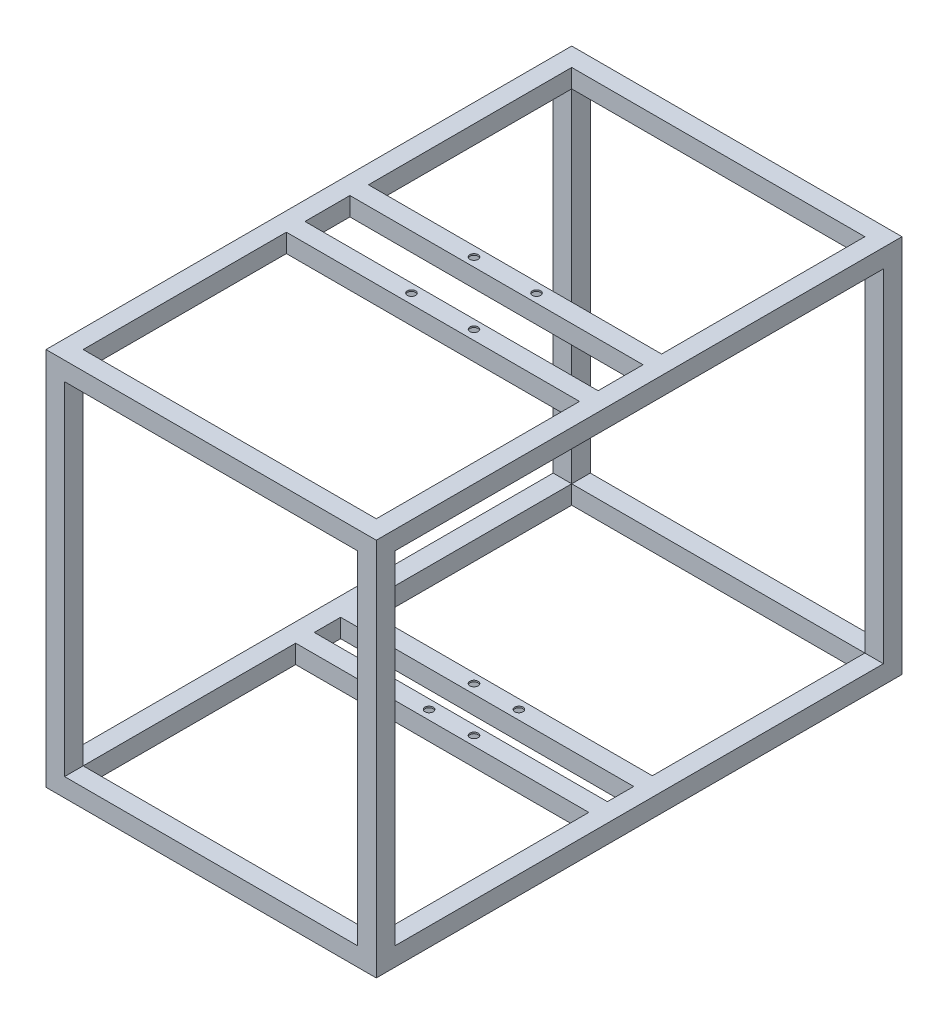
from build123d import *

# Parameters (mm, degrees)
SKETCH2_W                    = 19
SKETCH2_H                    = 19
SKETCH2_W_2                  = 16.6
SKETCH2_H_2                  = 16.6
SKETCH4_W                    = 19
SKETCH4_H                    = 19
SKETCH4_W_2                  = 16
SKETCH4_H_2                  = 16
SKETCH11_W                   = 19
SKETCH11_H                   = 19
SKETCH11_W_2                 = 16
SKETCH11_H_2                 = 16
M8_CLEARANCE_HOLE2_D         = 8.4
SKETCH15_W                   = 19
SKETCH15_H                   = 19
SKETCH15_W_2                 = 16
SKETCH15_H_2                 = 16
M8_START                     = -9.5
M8_CLEARANCE_HOLE1_OUTLINE_R = 4.2
M8_CLEARANCE_HOLE1_DEPTH     = 19


# Read off the part's stored shape, not the designer's step: M8 Clearance Hole1
with BuildPart() as part:
    # Sweep2: sweep along a path in Sketch1
    with BuildLine(Plane(origin=(0, 0, 0), x_dir=(1, 0, 0), z_dir=(0, 1, 0))) as sweep2_path:
        Line((150, 250), (-150, 250))
        Line((-150, 250), (-150, -250))
        Line((-150, -250), (150, -250))
        Line((150, -250), (150, 250))
    # Sketch2 → Sweep2 (sweep)
    with BuildSketch(Plane.XY):
        with Locations((-159.5, 0)):
            Rectangle(SKETCH2_W, SKETCH2_H)
        with Locations((-159.5, 0)):
            Rectangle(SKETCH2_W_2, SKETCH2_H_2, mode=Mode.SUBTRACT)
    sweep2 = sweep(path=sweep2_path.line, transition=Transition.RIGHT)

    # Sweep3: sweep along a path in Sketch3
    with BuildLine(Plane.XY.offset(250)) as sweep3_path:
        Line((-150, 9.5), (150, 9.5))
        Line((150, 9.5), (150, 359.5))
        Line((150, 359.5), (-150, 359.5))
        Line((-150, 359.5), (-150, 9.5))
    # Sketch4 → Sweep3 (sweep)
    with BuildSketch(Plane(origin=(0, 0, 0), x_dir=(0, 0, -1), z_dir=(1, 0, 0))):
        with Locations((-259.5, 0)):
            Rectangle(SKETCH4_W, SKETCH4_H)
        with Locations((-259.5, 0)):
            Rectangle(SKETCH4_W_2, SKETCH4_H_2, mode=Mode.SUBTRACT)
    sweep3 = sweep(path=sweep3_path.line, transition=Transition.RIGHT)

    # Mirror1: Sweep3 across plane
    add(sweep3.mirror(Plane.XY))

    # Mirror3: Sweep2 across plane
    add(sweep2.mirror(Plane(origin=(0, 184.5, 0), x_dir=(0, 0, 1), z_dir=(0, -1, 0))))

    # Sweep4: sweep along a path in Sketch10
    with BuildLine(Plane(origin=(0, 378.5, 0), x_dir=(1, 0, 0), z_dir=(0, 1, 0))) as sweep4_path:
        Line((150, -23), (-150, -23))
        Line((-150, -23), (-150, 23))
        Line((-150, 23), (150, 23))
        Line((150, 23), (150, -23))
    # Sketch11 → Sweep4 (sweep)
    with BuildSketch(Plane(origin=(0, 0, 0), x_dir=(0, 0, -1), z_dir=(1, 0, 0))):
        with Locations((-32.5, 369)):
            Rectangle(SKETCH11_W, SKETCH11_H)
        with Locations((-32.5, 369)):
            Rectangle(SKETCH11_W_2, SKETCH11_H_2, mode=Mode.SUBTRACT)
    sweep(path=sweep4_path.line, transition=Transition.RIGHT)

    # M8 Clearance Hole2 (through all)
    with Locations(Plane(origin=(0, 378.5, 0), x_dir=(1, 0, 0), z_dir=(0, 1, 0))):
        with Locations((-32, 32), (-32, -32), (32, -32), (32, 32)):
            Hole(M8_CLEARANCE_HOLE2_D / 2)

    # Sweep5: sweep along a path in Sketch5
    with BuildLine(Plane(origin=(0, 9.5, 0), x_dir=(-1, 0, 0), z_dir=(0, -1, 0))) as sweep5_path:
        Line((-150, 13.5), (150, 13.5))
        Line((150, 13.5), (150, -13.5))
        Line((150, -13.5), (-150, -13.5))
        Line((-150, -13.5), (-150, 13.5))
    # Sketch15 → Sweep5 (sweep)
    with BuildSketch(Plane(origin=(0, 0, 0), x_dir=(0, 0, -1), z_dir=(1, 0, 0))):
        with Locations((22.980970389, 0)):
            Rectangle(SKETCH15_W, SKETCH15_H)
        with Locations((22.980970389, 0)):
            Rectangle(SKETCH15_W_2, SKETCH15_H_2, mode=Mode.SUBTRACT)
    sweep(path=sweep5_path.line, transition=Transition.RIGHT)

    # M8 Clearance Hole1 outline → M8 Clearance Hole1 (cut)
    with BuildSketch(Plane(origin=(0, 0, 0), x_dir=(1, 0, 0), z_dir=(0, 1, 0)).offset(M8_START)):
        with Locations((22.980970389, -22.980970389)):
            Circle(M8_CLEARANCE_HOLE1_OUTLINE_R)
        with Locations((-22.980970389, -22.980970389)):
            Circle(M8_CLEARANCE_HOLE1_OUTLINE_R)
        with Locations((22.980970389, 22.980970389)):
            Circle(M8_CLEARANCE_HOLE1_OUTLINE_R)
        with Locations((-22.980970389, 22.980970389)):
            Circle(M8_CLEARANCE_HOLE1_OUTLINE_R)
    extrude(amount=M8_CLEARANCE_HOLE1_DEPTH, mode=Mode.SUBTRACT)


solid = part.part
